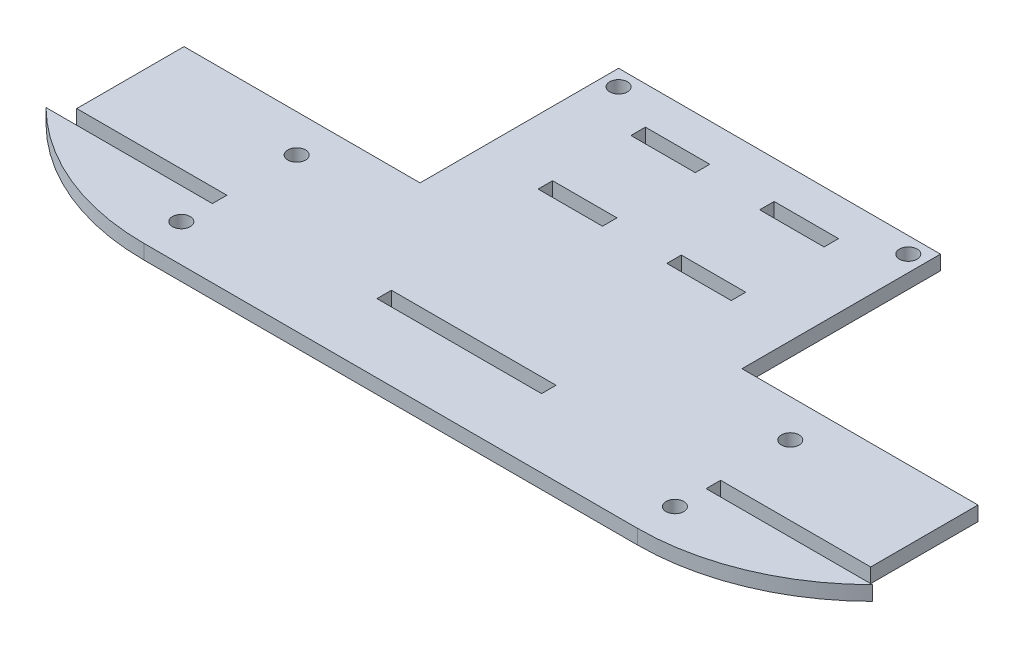
from build123d import *

# Parameters (mm, degrees)
SKETCH1_R           = 1.65
SKETCH1_W           = 30.68
SKETCH1_H           = 2.7
SKETCH1_W_2         = 12
BOSS_EXTRUDE1_DEPTH = 2.7


with BuildPart() as part:
    # Sketch1 → Boss-Extrude1 (new body)
    with BuildSketch(Plane(origin=(0, 0, 0), x_dir=(1, 0, 0), z_dir=(0, 1, 0))):
        with BuildLine():
            Line((-46, 0), (46, 0))
            ThreePointArc((46, 0), (62.780941571, 3.32568378), (77.025151087, 12.8))
            Line((77.025151087, 12.8), (46.015151087, 12.8))
            Line((46.015151087, 12.8), (46.015151087, 15.5))
            Line((46.015151087, 15.5), (73.995151087, 15.5))
            Line((73.995151087, 15.5), (73.995151087, 35.5))
            Line((73.995151087, 35.5), (30, 35.5))
            Line((30, 35.5), (30, 70.5))
            Line((30, 70.5), (30, 72.5))
            Line((30, 72.5), (-30, 72.5))
            Line((-30, 72.5), (-30, 70.5))
            Line((-30, 70.5), (-30, 35.5))
            Line((-30, 35.5), (-73.995151087, 35.5))
            Line((-73.995151087, 35.5), (-73.995151087, 15.5))
            Line((-73.995151087, 15.5), (-46.015151087, 15.5))
            Line((-46.015151087, 15.5), (-46.015151087, 12.8))
            Line((-46.015151087, 12.8), (-77.025151087, 12.8))
            ThreePointArc((-77.025151087, 12.8), (-62.780941571, 3.32568378), (-46, 0))
        make_face()
        with Locations((46, 28.5)):
            Circle(SKETCH1_R, mode=Mode.SUBTRACT)
        with Locations((46, 7)):
            Circle(SKETCH1_R, mode=Mode.SUBTRACT)
        with Locations((-46, 7)):
            Circle(SKETCH1_R, mode=Mode.SUBTRACT)
        with Locations((-46, 28.5)):
            Circle(SKETCH1_R, mode=Mode.SUBTRACT)
        with Locations((-27, 69.5)):
            Circle(SKETCH1_R, mode=Mode.SUBTRACT)
        with Locations((27, 69.5)):
            Circle(SKETCH1_R, mode=Mode.SUBTRACT)
        with Locations((0, 14.15)):
            Rectangle(SKETCH1_W, SKETCH1_H, mode=Mode.SUBTRACT)
        with Locations((12, 46.85)):
            Rectangle(SKETCH1_W_2, SKETCH1_H, mode=Mode.SUBTRACT)
        with Locations((-12, 64.15)):
            Rectangle(SKETCH1_W_2, SKETCH1_H, mode=Mode.SUBTRACT)
        with Locations((12, 64.15)):
            Rectangle(SKETCH1_W_2, SKETCH1_H, mode=Mode.SUBTRACT)
        with Locations((-12, 46.85)):
            Rectangle(SKETCH1_W_2, SKETCH1_H, mode=Mode.SUBTRACT)
    extrude(amount=BOSS_EXTRUDE1_DEPTH)


solid = part.part
